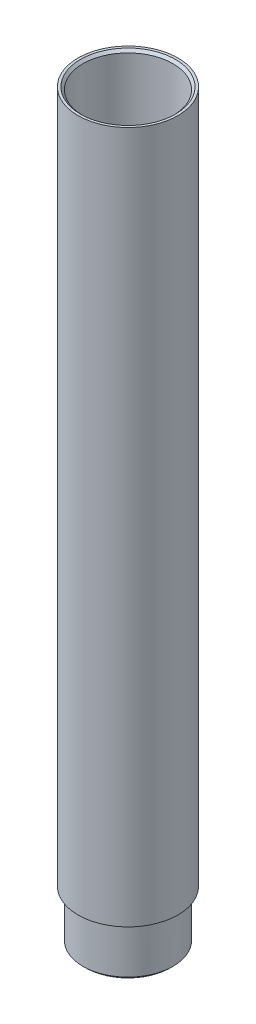
from build123d import *

# Parameters (mm, degrees)
SKETCH_1_R      = 20.2
SKETCH_1_R_2    = 18.2
EXTRUDE_1_DEPTH = 280
EXTRUDE_START   = 40
SKETCH_2_R      = 18.2
SKETCH_2_R_2    = 16.2
EXTRUDE_2_DEPTH = 40
CHAMFER_1_SIZE  = 1
CHAMFER_2_SIZE  = 1


with BuildPart() as part:
    # Эскиз1 → Бобышка-Вытянуть1 (new body)
    with BuildSketch(Plane(origin=(0, 0, 0), x_dir=(1, 0, 0), z_dir=(0, 1, 0))):
        Circle(SKETCH_1_R)
        Circle(SKETCH_1_R_2, mode=Mode.SUBTRACT)
    extrude(amount=EXTRUDE_1_DEPTH)

    # Эскиз2 → Бобышка-Вытянуть2 (add)
    with BuildSketch(Plane(origin=(0, 20, 0), x_dir=(-1, 0, 0), z_dir=(0, -1, 0)).offset(EXTRUDE_START)):
        Circle(SKETCH_2_R)
        Circle(SKETCH_2_R_2, mode=Mode.SUBTRACT)
    extrude(amount=-EXTRUDE_2_DEPTH)

    # Фаска1
    chamfer_1_edges = [part.edges().sort_by_distance(p)[0] for p in [
        (18.2, -20, 0),
    ]]
    chamfer(chamfer_1_edges, length=CHAMFER_1_SIZE)

    # Фаска2
    chamfer_2_edges = [part.edges().sort_by_distance(p)[0] for p in [
        (-18.2, 280, 0),
    ]]
    chamfer(chamfer_2_edges, length=CHAMFER_2_SIZE)


solid = part.part
